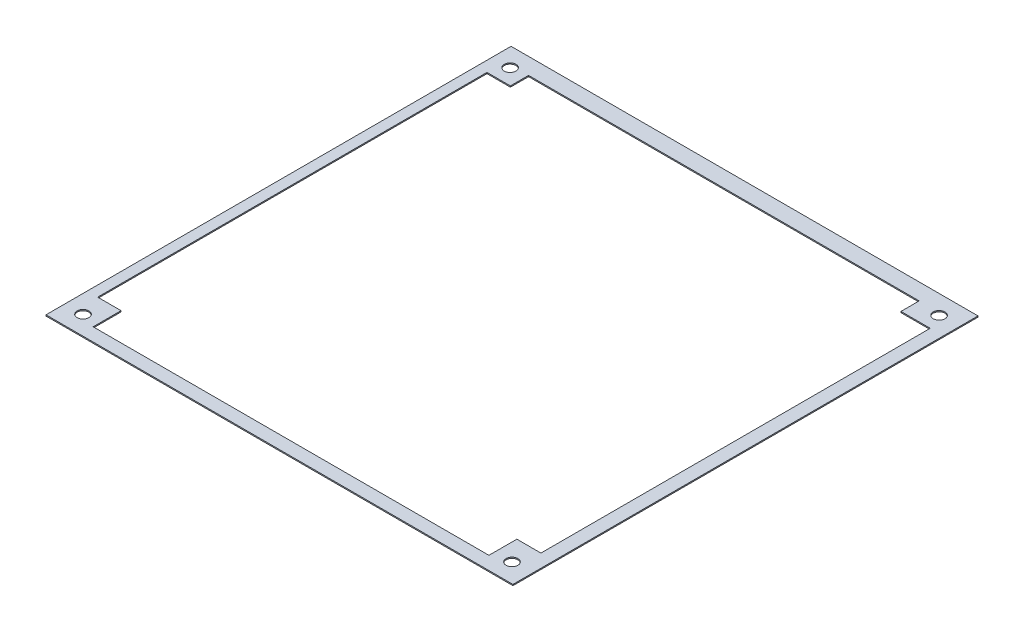
from build123d import *

# Parameters (mm, degrees)
BOSS_EXTRUDE1_DEPTH   = 5.5
BOSS_EXTRUDE1_2_DEPTH = 5.5
SKETCH2_W             = 112.4
SKETCH2_H             = 112.4
BOSS_EXTRUDE2_DEPTH   = 9.4
BOSS_EXTRUDE3_START   = 9.4
SKETCH2_3_W           = 246
SKETCH2_3_H           = 245
BOSS_EXTRUDE3_DEPTH   = 6
SKETCH3_R             = 3.1
CUT_EXTRUDE1_DEPTH    = 251.310147617
BOSS_EXTRUDE4_DEPTH   = 15
SKETCH5_W             = 16
SKETCH5_H             = 22.5
BOSS_EXTRUDE5_DEPTH   = 3.9
SKETCH6_W             = 16
SKETCH6_H             = 20.5
CUT_EXTRUDE2_DEPTH    = 3.4
CHAMFER1_SIZE         = 2
CHAMFER2_SIZE         = 3.05
CHAMFER3_SIZE         = 3
CHAMFER4_SIZE         = 3
SKETCH8_W             = 79.1
SKETCH8_H             = 5
CUT_EXTRUDE3_DEPTH    = 0.1
SKETCH9_W             = 246
SKETCH9_H             = 27.9
CUT_EXTRUDE4_DEPTH    = 324.051327191
CUT_EXTRUDE5_DEPTH    = 250.867004624


with BuildPart() as part:
    # Sketch1 → Boss-Extrude1 (new body)
    with BuildSketch(Plane(origin=(0, 0, 0), x_dir=(1, 0, 0), z_dir=(0, 1, 0))):
        Polygon((-6, -6), (-6, 106.4), (7.7, 106.4), (7.7, 100.4), (0, 100.4), (0, 0), (100.4, 0), (100.4, 40.9), (106.4, 40.9), (106.4, -6), align=None)
    extrude(amount=BOSS_EXTRUDE1_DEPTH)



with BuildPart() as body_2:
    # Sketch1 → Boss-Extrude1 2 (new body)
    with BuildSketch(Plane(origin=(0, 0, 0), x_dir=(1, 0, 0), z_dir=(0, 1, 0))):
        Polygon((92.7, 100.4), (92.7, 106.4), (106.4, 106.4), (106.4, 59.5), (100.4, 59.5), (100.4, 100.4), align=None)
    extrude(amount=BOSS_EXTRUDE1_2_DEPTH)


with BuildPart() as part_1:
    add(part.part)

    add(body_2.part)  # Boss-Extrude2 merges body 2
    # Sketch2 → Boss-Extrude2 (add)
    with BuildSketch(Plane.XZ):
        with Locations((50.2, -50.2)):
            Rectangle(SKETCH2_W, SKETCH2_H)
    extrude(amount=BOSS_EXTRUDE2_DEPTH)

    # Sketch2<3> → Boss-Extrude3 (add)
    with BuildSketch(Plane.XZ.offset(BOSS_EXTRUDE3_START)):
        with Locations((87, -12.9)):
            Rectangle(SKETCH2_3_W, SKETCH2_3_H)
    extrude(amount=BOSS_EXTRUDE3_DEPTH)

    # Sketch3 → Cut-Extrude1 (cut, through all)
    with BuildSketch(Plane(origin=(0, -9.4, 0), x_dir=(1, 0, 0), z_dir=(0, 1, 0))):
        with Locations(Location((-26.5, 125.4, 0), (0, 0, 270))):
            Circle(SKETCH3_R)
        with Locations(Location((-26.5, -99.6, 0), (0, 0, 90))):
            Circle(SKETCH3_R)
        with Locations(Location((199.5, 125.4, 0), (0, 0, 270))):
            Circle(SKETCH3_R)
        with Locations(Location((199.5, -99.6, 0), (0, 0, 270))):
            Circle(SKETCH3_R)
    extrude(amount=-CUT_EXTRUDE1_DEPTH, mode=Mode.SUBTRACT)

    # Sketch4 → Boss-Extrude4 (add)
    with BuildSketch(Plane(origin=(0, -9.4, 0), x_dir=(1, 0, 0), z_dir=(0, 1, 0))):
        with BuildLine():
            Line((-16, -109.6), (49, -109.6))
            Line((49, -109.6), (49, -6))
            Line((49, -6), (-36, -6))
            Line((-36, -6), (-36, -89.6))
            Line((-36, -89.6), (-22, -89.6))
            ThreePointArc((-22, -89.6), (-17.757359313, -91.357359313), (-16, -95.6))
            Line((-16, -95.6), (-16, -109.6))
        make_face()
    extrude(amount=BOSS_EXTRUDE4_DEPTH)

    # Sketch5 → Boss-Extrude5 (add)
    with BuildSketch(Plane(origin=(0, 0, -106.4), x_dir=(-1, 0, 0), z_dir=(0, 0, -1))):
        with Locations((-99.9, 1.85)):
            Rectangle(SKETCH5_W, SKETCH5_H)
        with Locations((-0.5, 1.85)):
            Rectangle(SKETCH5_W, SKETCH5_H)
    extrude(amount=BOSS_EXTRUDE5_DEPTH)

    # Sketch6 → Cut-Extrude2 (cut)
    with BuildSketch(Plane(origin=(0, 0, -110.3), x_dir=(-1, 0, 0), z_dir=(0, 0, -1))):
        with Locations((-0.5, 0.85)):
            Rectangle(SKETCH6_W, SKETCH6_H)
        with Locations((-99.9, 0.85)):
            Rectangle(SKETCH6_W, SKETCH6_H)
    extrude(amount=-CUT_EXTRUDE2_DEPTH, mode=Mode.SUBTRACT)

    # Chamfer1
    # the kernel refuses this chamfer: 2 mm, written as the material it adds along each edge
    with BuildSketch(Plane(origin=(92.7, -5.143365976, -106.4), x_dir=(-0.9996219169112968, 0, -0.027495876610589005), z_dir=(0, 1, 0))) as chamfer1_piece_1_section:
        Polygon((CHAMFER1_SIZE * 0.999621916911, CHAMFER1_SIZE * 0.0274958766106), (-CHAMFER1_SIZE * 0.0274958766106, CHAMFER1_SIZE * 0.999621916911), (0, 0), align=None)
    chamfer1_piece_1 = extrude(amount=10.643365976, mode=Mode.PRIVATE)
    chamfer1_piece_1 = split(chamfer1_piece_1, bisect_by=Plane(origin=(91.9, -2.571682988, -105.57221902), z_dir=(1, 0, 0)), keep=Keep.TOP, mode=Mode.PRIVATE)
    add(chamfer1_piece_1)
    with BuildSketch(Plane(origin=(92.7, 5.5, -106.4), x_dir=(0, 0.9996219169112968, -0.027495876610589075), z_dir=(1, 0, 0)), Plane(origin=(-6, 5.5, -106.4), x_dir=(0, 0.9996219169112968, -0.027495876610589075), z_dir=(1, 0, 0))) as chamfer1_piece_2:
        Polygon((CHAMFER1_SIZE * 0.999621916911, CHAMFER1_SIZE * 0.0274958766106), (-CHAMFER1_SIZE * 0.0274958766106, CHAMFER1_SIZE * 0.999621916911), (0, 0), align=None)
    extrude(amount=13.7)
    with BuildSketch(Plane(origin=(106.4, 5.5, -106.4), x_dir=(-0.027495876610589005, 0, 0.9996219169112968), z_dir=(0, -1, 0))) as chamfer1_piece_3_section:
        Polygon((CHAMFER1_SIZE * 0.999621916911, -CHAMFER1_SIZE * 0.0274958766106), (-CHAMFER1_SIZE * 0.0274958766106, -CHAMFER1_SIZE * 0.999621916911), (0, 0), align=None)
    chamfer1_piece_3 = extrude(amount=14.9, mode=Mode.PRIVATE)
    chamfer1_piece_3 = split(chamfer1_piece_3, bisect_by=Plane(origin=(107.9, -1.95, -105.69608178), z_dir=(-1, 0, 0)), keep=Keep.TOP, mode=Mode.PRIVATE)
    add(chamfer1_piece_3)
    with BuildSketch(Plane(origin=(106.4, 5.5, -106.4), x_dir=(-0.027495876610589005, 0, 0.9996219169112968), z_dir=(0, -1, 0))) as chamfer1_piece_4_section:
        Polygon((CHAMFER1_SIZE * 0.999621916911, -CHAMFER1_SIZE * 0.0274958766106), (-CHAMFER1_SIZE * 0.0274958766106, -CHAMFER1_SIZE * 0.999621916911), (0, 0), align=None)
    chamfer1_piece_4 = extrude(amount=20.043365976, mode=Mode.PRIVATE)
    chamfer1_piece_4 = split(chamfer1_piece_4, bisect_by=Plane(origin=(106.974972825, -9.4, -105.69608178), z_dir=(0, -1, 0)), keep=Keep.TOP, mode=Mode.PRIVATE)
    chamfer1_piece_4 = split(chamfer1_piece_4, bisect_by=Plane(origin=(107.9, -11.971682988, -105.69608178), z_dir=(-1, 0, 0)), keep=Keep.TOP, mode=Mode.PRIVATE)
    add(chamfer1_piece_4)
    with BuildSketch(Plane(origin=(106.4, 5.5, -106.4), x_dir=(-0.027495876610589005, 0, 0.9996219169112968), z_dir=(0, -1, 0))) as chamfer1_piece_5_section:
        Polygon((CHAMFER1_SIZE * 0.999621916911, -CHAMFER1_SIZE * 0.0274958766106), (-CHAMFER1_SIZE * 0.0274958766106, -CHAMFER1_SIZE * 0.999621916911), (0, 0), align=None)
    chamfer1_piece_5 = extrude(amount=20.043365976, mode=Mode.PRIVATE)
    chamfer1_piece_5 = split(chamfer1_piece_5, bisect_by=Plane(origin=(108.09753906, -9.4, -106.284213701), z_dir=(0, -1, 0)), keep=Keep.TOP, mode=Mode.PRIVATE)
    chamfer1_piece_5 = split(chamfer1_piece_5, bisect_by=Plane(origin=(107.9, -11.971682988, -106.284213701), z_dir=(1, 0, 0)), keep=Keep.TOP, mode=Mode.PRIVATE)
    add(chamfer1_piece_5)
    with BuildSketch(Plane(origin=(7.7, -5.143365976, -106.4), x_dir=(0.9996219169112965, 0, -0.027495876610589057), z_dir=(0, 1, 0))) as chamfer1_piece_6_section:
        Polygon((CHAMFER1_SIZE * 0.999621916911, -CHAMFER1_SIZE * 0.0274958766106), (-CHAMFER1_SIZE * 0.0274958766106, -CHAMFER1_SIZE * 0.999621916911), (0, 0), align=None)
    chamfer1_piece_6 = extrude(amount=10.643365976, mode=Mode.PRIVATE)
    chamfer1_piece_6 = split(chamfer1_piece_6, bisect_by=Plane(origin=(8.5, -2.571682988, -105.57221902), z_dir=(-1, 0, 0)), keep=Keep.TOP, mode=Mode.PRIVATE)
    add(chamfer1_piece_6)
    with BuildSketch(Plane(origin=(-6, 5.5, -106.4), x_dir=(-0.9996219169112968, 0, -0.027495876610589075), z_dir=(0, -1, 0))) as chamfer1_piece_7_section:
        Polygon((CHAMFER1_SIZE * 0.999621916911, -CHAMFER1_SIZE * 0.0274958766106), (-CHAMFER1_SIZE * 0.0274958766106, -CHAMFER1_SIZE * 0.999621916911), (0, 0), align=None)
    chamfer1_piece_7 = extrude(amount=14.9, mode=Mode.PRIVATE)
    chamfer1_piece_7 = split(chamfer1_piece_7, bisect_by=Plane(origin=(-7.5, -1.95, -105.69608178), z_dir=(1, 0, 0)), keep=Keep.TOP, mode=Mode.PRIVATE)
    add(chamfer1_piece_7)
    with BuildSketch(Plane(origin=(-6, 5.5, -106.4), x_dir=(-0.9996219169112968, 0, -0.027495876610589075), z_dir=(0, -1, 0))) as chamfer1_piece_8_section:
        Polygon((CHAMFER1_SIZE * 0.999621916911, -CHAMFER1_SIZE * 0.0274958766106), (-CHAMFER1_SIZE * 0.0274958766106, -CHAMFER1_SIZE * 0.999621916911), (0, 0), align=None)
    chamfer1_piece_8 = extrude(amount=20.043365976, mode=Mode.PRIVATE)
    chamfer1_piece_8 = split(chamfer1_piece_8, bisect_by=Plane(origin=(-7.69753906, -9.4, -106.284213701), z_dir=(0, -1, 0)), keep=Keep.TOP, mode=Mode.PRIVATE)
    chamfer1_piece_8 = split(chamfer1_piece_8, bisect_by=Plane(origin=(-7.5, -11.971682988, -106.284213701), z_dir=(-1, 0, 0)), keep=Keep.TOP, mode=Mode.PRIVATE)
    add(chamfer1_piece_8)
    with BuildSketch(Plane(origin=(-6, 5.5, -106.4), x_dir=(-0.9996219169112968, 0, -0.027495876610589075), z_dir=(0, -1, 0))) as chamfer1_piece_9_section:
        Polygon((CHAMFER1_SIZE * 0.999621916911, -CHAMFER1_SIZE * 0.0274958766106), (-CHAMFER1_SIZE * 0.0274958766106, -CHAMFER1_SIZE * 0.999621916911), (0, 0), align=None)
    chamfer1_piece_9 = extrude(amount=20.043365976, mode=Mode.PRIVATE)
    chamfer1_piece_9 = split(chamfer1_piece_9, bisect_by=Plane(origin=(-6.574972825, -9.4, -105.69608178), z_dir=(0, -1, 0)), keep=Keep.TOP, mode=Mode.PRIVATE)
    chamfer1_piece_9 = split(chamfer1_piece_9, bisect_by=Plane(origin=(-7.5, -11.971682988, -105.69608178), z_dir=(1, 0, 0)), keep=Keep.TOP, mode=Mode.PRIVATE)
    add(chamfer1_piece_9)
    with BuildSketch(Plane(origin=(87.556634024, 5.5, -106.4), x_dir=(0, 0.9996219169112968, -0.027495876610589075), z_dir=(1, 0, 0))) as chamfer1_piece_10a_section:
        Polygon((CHAMFER1_SIZE * 0.999621916911, CHAMFER1_SIZE * 0.0274958766106), (-CHAMFER1_SIZE * 0.0274958766106, CHAMFER1_SIZE * 0.999621916911), (0, 0), align=None)
    chamfer1_piece_10a = extrude(amount=18.843365976, mode=Mode.PRIVATE)
    chamfer1_piece_10a = split(chamfer1_piece_10a, bisect_by=Plane(origin=(91.9, 6.159587254, -105.740412746), z_dir=(1, 0, 0)), keep=Keep.TOP, mode=Mode.PRIVATE)
    chamfer1_piece_10a = split(chamfer1_piece_10a, bisect_by=Plane(origin=(92.7, 6.159587254, -105.740412746), z_dir=(-1, 0, 0)), keep=Keep.TOP, mode=Mode.PRIVATE)
    with BuildSketch(Plane(origin=(92.7, 0, -106.4), x_dir=(-0.9996219169112968, 0, -0.027495876610589005), z_dir=(0, 1, 0))) as chamfer1_piece_10b_section:
        Polygon((CHAMFER1_SIZE * 0.999621916911, CHAMFER1_SIZE * 0.0274958766106), (-CHAMFER1_SIZE * 0.0274958766106, CHAMFER1_SIZE * 0.999621916911), (0, 0), align=None)
    chamfer1_piece_10b = extrude(amount=10.643365976, mode=Mode.PRIVATE)
    chamfer1_piece_10b = split(chamfer1_piece_10b, bisect_by=Plane(origin=(91.9, 8.071682988, -105.57221902), z_dir=(1, 0, 0)), keep=Keep.TOP, mode=Mode.PRIVATE)
    chamfer1_piece_10b = split(chamfer1_piece_10b, bisect_by=Plane(origin=(92.36112716, 5.5, -105.57221902), z_dir=(0, 1, 0)), keep=Keep.TOP, mode=Mode.PRIVATE)
    chamfer1_piece_10 = chamfer1_piece_10a & chamfer1_piece_10b
    add(chamfer1_piece_10)
    with BuildSketch(Plane(origin=(106.4, 10.643365976, -106.4), x_dir=(-0.027495876610589005, 0, 0.9996219169112968), z_dir=(0, -1, 0))) as chamfer1_piece_11a_section:
        Polygon((CHAMFER1_SIZE * 0.999621916911, -CHAMFER1_SIZE * 0.0274958766106), (-CHAMFER1_SIZE * 0.0274958766106, -CHAMFER1_SIZE * 0.999621916911), (0, 0), align=None)
    chamfer1_piece_11a = extrude(amount=20.043365976, mode=Mode.PRIVATE)
    chamfer1_piece_11a = split(chamfer1_piece_11a, bisect_by=Plane(origin=(106.974972825, 5.5, -105.69608178), z_dir=(0, 1, 0)), keep=Keep.TOP, mode=Mode.PRIVATE)
    chamfer1_piece_11a = split(chamfer1_piece_11a, bisect_by=Plane(origin=(107.9, 8.071682988, -105.69608178), z_dir=(-1, 0, 0)), keep=Keep.TOP, mode=Mode.PRIVATE)
    with BuildSketch(Plane(origin=(92.7, 5.5, -106.4), x_dir=(0, 0.9996219169112968, -0.027495876610589075), z_dir=(1, 0, 0))) as chamfer1_piece_11b_section:
        Polygon((CHAMFER1_SIZE * 0.999621916911, CHAMFER1_SIZE * 0.0274958766106), (-CHAMFER1_SIZE * 0.0274958766106, CHAMFER1_SIZE * 0.999621916911), (0, 0), align=None)
    chamfer1_piece_11b = extrude(amount=18.843365976, mode=Mode.PRIVATE)
    chamfer1_piece_11b = split(chamfer1_piece_11b, bisect_by=Plane(origin=(106.4, 6.159587254, -105.740412746), z_dir=(1, 0, 0)), keep=Keep.TOP, mode=Mode.PRIVATE)
    chamfer1_piece_11b = split(chamfer1_piece_11b, bisect_by=Plane(origin=(107.9, 6.159587254, -105.740412746), z_dir=(-1, 0, 0)), keep=Keep.TOP, mode=Mode.PRIVATE)
    chamfer1_piece_11 = chamfer1_piece_11a & chamfer1_piece_11b
    add(chamfer1_piece_11)
    with BuildSketch(Plane(origin=(-6, 5.5, -106.4), x_dir=(0, 0.9996219169112968, -0.027495876610589075), z_dir=(1, 0, 0))) as chamfer1_piece_12a_section:
        Polygon((CHAMFER1_SIZE * 0.999621916911, CHAMFER1_SIZE * 0.0274958766106), (-CHAMFER1_SIZE * 0.0274958766106, CHAMFER1_SIZE * 0.999621916911), (0, 0), align=None)
    chamfer1_piece_12a = extrude(amount=18.843365976, mode=Mode.PRIVATE)
    chamfer1_piece_12a = split(chamfer1_piece_12a, bisect_by=Plane(origin=(8.5, 6.159587254, -105.740412746), z_dir=(-1, 0, 0)), keep=Keep.TOP, mode=Mode.PRIVATE)
    chamfer1_piece_12a = split(chamfer1_piece_12a, bisect_by=Plane(origin=(7.7, 6.159587254, -105.740412746), z_dir=(1, 0, 0)), keep=Keep.TOP, mode=Mode.PRIVATE)
    with BuildSketch(Plane(origin=(7.7, 0, -106.4), x_dir=(0.9996219169112965, 0, -0.027495876610589057), z_dir=(0, 1, 0))) as chamfer1_piece_12b_section:
        Polygon((CHAMFER1_SIZE * 0.999621916911, -CHAMFER1_SIZE * 0.0274958766106), (-CHAMFER1_SIZE * 0.0274958766106, -CHAMFER1_SIZE * 0.999621916911), (0, 0), align=None)
    chamfer1_piece_12b = extrude(amount=10.643365976, mode=Mode.PRIVATE)
    chamfer1_piece_12b = split(chamfer1_piece_12b, bisect_by=Plane(origin=(8.5, 8.071682988, -105.57221902), z_dir=(-1, 0, 0)), keep=Keep.TOP, mode=Mode.PRIVATE)
    chamfer1_piece_12b = split(chamfer1_piece_12b, bisect_by=Plane(origin=(8.03887284, 5.5, -105.57221902), z_dir=(0, 1, 0)), keep=Keep.TOP, mode=Mode.PRIVATE)
    chamfer1_piece_12 = chamfer1_piece_12a & chamfer1_piece_12b
    add(chamfer1_piece_12)
    with BuildSketch(Plane(origin=(-6, 10.643365976, -106.4), x_dir=(-0.9996219169112968, 0, -0.027495876610589075), z_dir=(0, -1, 0))) as chamfer1_piece_13a_section:
        Polygon((CHAMFER1_SIZE * 0.999621916911, -CHAMFER1_SIZE * 0.0274958766106), (-CHAMFER1_SIZE * 0.0274958766106, -CHAMFER1_SIZE * 0.999621916911), (0, 0), align=None)
    chamfer1_piece_13a = extrude(amount=20.043365976, mode=Mode.PRIVATE)
    chamfer1_piece_13a = split(chamfer1_piece_13a, bisect_by=Plane(origin=(-7.5, 8.071682988, -105.69608178), z_dir=(1, 0, 0)), keep=Keep.TOP, mode=Mode.PRIVATE)
    chamfer1_piece_13a = split(chamfer1_piece_13a, bisect_by=Plane(origin=(-6.574972825, 5.5, -105.69608178), z_dir=(0, 1, 0)), keep=Keep.TOP, mode=Mode.PRIVATE)
    with BuildSketch(Plane(origin=(-11.143365976, 5.5, -106.4), x_dir=(0, 0.9996219169112968, -0.027495876610589075), z_dir=(1, 0, 0))) as chamfer1_piece_13b_section:
        Polygon((CHAMFER1_SIZE * 0.999621916911, CHAMFER1_SIZE * 0.0274958766106), (-CHAMFER1_SIZE * 0.0274958766106, CHAMFER1_SIZE * 0.999621916911), (0, 0), align=None)
    chamfer1_piece_13b = extrude(amount=18.843365976, mode=Mode.PRIVATE)
    chamfer1_piece_13b = split(chamfer1_piece_13b, bisect_by=Plane(origin=(-7.5, 6.159587254, -105.740412746), z_dir=(1, 0, 0)), keep=Keep.TOP, mode=Mode.PRIVATE)
    chamfer1_piece_13b = split(chamfer1_piece_13b, bisect_by=Plane(origin=(-6, 6.159587254, -105.740412746), z_dir=(-1, 0, 0)), keep=Keep.TOP, mode=Mode.PRIVATE)
    chamfer1_piece_13 = chamfer1_piece_13a & chamfer1_piece_13b
    add(chamfer1_piece_13)
    # the kernel refuses this chamfer: 2 mm, written as the material it takes off along each edge
    with BuildSketch(Plane(origin=(113.043365976, 13.1, -106.4), x_dir=(1.4427442484973125e-15, -0.9996219169112968, 0.027495876610589075), z_dir=(-1, 0, 0)), Plane(origin=(-12.643365976, 13.1, -106.4), x_dir=(0, 0.027495876610586414, -0.9996219169112968), z_dir=(1, 0, 0))) as chamfer1_2_piece_1:
        Polygon((CHAMFER1_SIZE * 0.999621916911, -CHAMFER1_SIZE * 0.0274958766106), (-CHAMFER1_SIZE * 0.0274958766106, -CHAMFER1_SIZE * 0.999621916911), (0, 0), align=None)
    extrude(amount=26.286731952, mode=Mode.SUBTRACT)

    # Chamfer2
    chamfer2_edges = [part_1.edges().sort_by_distance(p)[0] for p in [
        (199.5, -9.4, -128.5),
        (-26.5, -9.4, -128.5),
        (-26.5, -9.4, 102.7),
        (199.5, -9.4, 96.5),
    ]]
    chamfer(chamfer2_edges, length=CHAMFER2_SIZE)

    # Chamfer3
    chamfer3_edges = [part_1.edges().sort_by_distance(p)[0] for p in [
        (106.4, 5.5, -17.45),
    ]]
    chamfer(chamfer3_edges, length=CHAMFER3_SIZE)
    chamfer3_2_edges = [part_1.edges().sort_by_distance(p)[0] for p in [
        (106.4, 5.5, -81.95),
    ]]
    chamfer(chamfer3_2_edges, length=CHAMFER3_SIZE)
    chamfer3_3_edges = [part_1.edges().sort_by_distance(p)[0] for p in [
        (76.2, 5.5, 6),
    ]]
    chamfer(chamfer3_3_edges, length=CHAMFER3_SIZE)
    chamfer3_4_edges = [part_1.edges().sort_by_distance(p)[0] for p in [
        (49, 5.6, 57.8),
    ]]
    chamfer(chamfer3_4_edges, length=CHAMFER3_SIZE)
    chamfer3_5_edges = [part_1.edges().sort_by_distance(p)[0] for p in [
        (15, 5.6, 109.6),
    ]]
    chamfer(chamfer3_5_edges, length=CHAMFER3_SIZE)
    chamfer3_6_edges = [part_1.edges().sort_by_distance(p)[0] for p in [
        (-36, 5.6, 47.8),
    ]]
    chamfer(chamfer3_6_edges, length=CHAMFER3_SIZE)
    chamfer3_7_edges = [part_1.edges().sort_by_distance(p)[0] for p in [
        (-6, 5.5, -49.2),
    ]]
    chamfer(chamfer3_7_edges, length=CHAMFER3_SIZE)
    chamfer3_8_edges = [part_1.edges().sort_by_distance(p)[0] for p in [
        (-16, 5.6, 101.1),
        (-27.5, 5.6, 89.6),
        (-17.757359313, 5.6, 91.357359313),
    ]]
    chamfer(chamfer3_8_edges, length=CHAMFER3_SIZE)

    # Chamfer4
    chamfer4_edges = [part_1.edges().sort_by_distance(p)[0] for p in [
        (-36, -9.4, -64.7),
        (129.5, -9.4, 109.6),
        (-36, -3.4, 89.6),
        (-36, -3.4, 6),
        (-16, -3.4, 109.6),
        (49, -3.4, 109.6),
        (-36, -9.4, 99.6),
        (87, -9.4, -135.4),
        (-26, -9.4, 109.6),
        (210, -9.4, -12.9),
    ]]
    chamfer(chamfer4_edges, length=CHAMFER4_SIZE)

    # Sketch8 → Cut-Extrude3 (cut)
    with BuildSketch(Plane(origin=(0, 5.6, 0), x_dir=(1, 0, 0), z_dir=(0, 1, 0))):
        with Locations((6.55, -8.5)):
            Rectangle(SKETCH8_W, SKETCH8_H)
    extrude(amount=-CUT_EXTRUDE3_DEPTH, mode=Mode.SUBTRACT)

    # Chamfer5
    # the kernel refuses this chamfer: 3 mm, written as the material it takes off along each edge
    with BuildSketch(Plane(origin=(6.229157809, 5.5, 6), x_dir=(0, -0.9850292351397439, -0.17238737169529297), z_dir=(-1, 0, 0))) as chamfer5_piece_1_section:
        with BuildLine():
            Line((3.691663124, 0), (-1.253737533, 3.472249821))
            Line((-1.253737533, 3.472249821), (-1.697000689, 3.394675503))
            ThreePointArc((-1.697000689, 3.394675503), (-0.756697539, 1.713403919), (-0.443263156, -0.077574317))
            Line((-0.443263156, -0.077574317), (0.077574317, -0.443263156))
            ThreePointArc((0.077574317, -0.443263156), (1.868552553, -0.129828772), (3.769237441, -0.443263156))
            Line((3.769237441, -0.443263156), (3.691663124, 0))
        make_face()
    chamfer5_piece_1 = extrude(amount=39.229157809, mode=Mode.PRIVATE)
    chamfer5_piece_1 = split(chamfer5_piece_1, bisect_by=Plane(origin=(-4.039459416, 4.460540584, 7.280331392), z_dir=(-0.7071067811865476, 0.7071067811865476, 0)), keep=Keep.TOP, mode=Mode.PRIVATE)
    chamfer5_piece_1 = split(chamfer5_piece_1, bisect_by=Plane(origin=(-6, 5.114054112, 7.280331392), z_dir=(1, 0, 0)), keep=Keep.TOP, mode=Mode.PRIVATE)
    add(chamfer5_piece_1, mode=Mode.SUBTRACT)
    with BuildSketch(Plane(origin=(6.229157809, 5.5, 6), x_dir=(0, -0.9850292351397439, -0.17238737169529297), z_dir=(-1, 0, 0))) as chamfer5_piece_2_section:
        with BuildLine():
            Line((3.691663124, 0), (-1.253737533, 3.472249821))
            Line((-1.253737533, 3.472249821), (-1.697000689, 3.394675503))
            ThreePointArc((-1.697000689, 3.394675503), (-0.756697539, 1.713403919), (-0.443263156, -0.077574317))
            Line((-0.443263156, -0.077574317), (0.077574317, -0.443263156))
            ThreePointArc((0.077574317, -0.443263156), (1.868552553, -0.129828772), (3.769237441, -0.443263156))
            Line((3.769237441, -0.443263156), (3.691663124, 0))
        make_face()
    chamfer5_piece_2 = extrude(amount=39.229157809, mode=Mode.PRIVATE)
    chamfer5_piece_2 = split(chamfer5_piece_2, bisect_by=Plane(origin=(-6.302738925, 2.197261075, 5.315019574), z_dir=(0.7071067811865476, -0.7071067811865476, 0)), keep=Keep.TOP, mode=Mode.PRIVATE)
    chamfer5_piece_2 = split(chamfer5_piece_2, bisect_by=Plane(origin=(-6, 2.0963481, 5.315019574), z_dir=(-1, 0, 0)), keep=Keep.TOP, mode=Mode.PRIVATE)
    add(chamfer5_piece_2, mode=Mode.SUBTRACT)
    with BuildSketch(Plane(origin=(6.229157809, 5.5, 6), x_dir=(0, -0.9850292351397439, -0.17238737169529297), z_dir=(-1, 0, 0))) as chamfer5_piece_3_section:
        with BuildLine():
            Line((3.691663124, 0), (-1.253737533, 3.472249821))
            Line((-1.253737533, 3.472249821), (-1.697000689, 3.394675503))
            ThreePointArc((-1.697000689, 3.394675503), (-0.756697539, 1.713403919), (-0.443263156, -0.077574317))
            Line((-0.443263156, -0.077574317), (0.077574317, -0.443263156))
            ThreePointArc((0.077574317, -0.443263156), (1.868552553, -0.129828772), (3.769237441, -0.443263156))
            Line((3.769237441, -0.443263156), (3.691663124, 0))
        make_face()
    chamfer5_piece_3 = extrude(amount=39.229157809, mode=Mode.PRIVATE)
    chamfer5_piece_3 = split(chamfer5_piece_3, bisect_by=Plane(origin=(-11.711520685, -3.211520685, 6.918404597), z_dir=(-0.7071067811865476, 0.7071067811865476, 0)), keep=Keep.TOP, mode=Mode.PRIVATE)
    chamfer5_piece_3 = split(chamfer5_piece_3, bisect_by=Plane(origin=(-6, 4.583653926, 6.918404597), z_dir=(-1, 0, 0)), keep=Keep.TOP, mode=Mode.PRIVATE)
    add(chamfer5_piece_3, mode=Mode.SUBTRACT)
    with BuildSketch(Plane(origin=(6.229157809, 5.5, 6), x_dir=(0, -0.9850292351397439, -0.17238737169529297), z_dir=(-1, 0, 0))) as chamfer5_piece_4_section:
        with BuildLine():
            Line((3.691663124, 0), (-1.253737533, 3.472249821))
            Line((-1.253737533, 3.472249821), (-1.697000689, 3.394675503))
            ThreePointArc((-1.697000689, 3.394675503), (-0.756697539, 1.713403919), (-0.443263156, -0.077574317))
            Line((-0.443263156, -0.077574317), (0.077574317, -0.443263156))
            ThreePointArc((0.077574317, -0.443263156), (1.868552553, -0.129828772), (3.769237441, -0.443263156))
            Line((3.769237441, -0.443263156), (3.691663124, 0))
        make_face()
    chamfer5_piece_4 = extrude(amount=48.458315618, mode=Mode.PRIVATE)
    chamfer5_piece_4 = split(chamfer5_piece_4, bisect_by=Plane(origin=(-33, 4.582402261, 6.917597739), z_dir=(-1, 0, 0)), keep=Keep.TOP, mode=Mode.PRIVATE)
    add(chamfer5_piece_4, mode=Mode.SUBTRACT)

    # Sketch9 → Cut-Extrude4 (cut, through all)
    with BuildSketch(Plane.XY.offset(109.6)):
        with Locations((87, -0.85)):
            Rectangle(SKETCH9_W, SKETCH9_H)
    extrude(amount=-CUT_EXTRUDE4_DEPTH, mode=Mode.SUBTRACT)

    # Sketch10 → Cut-Extrude5 (cut, through all)
    with BuildSketch(Plane(origin=(0, -14.8, 0), x_dir=(1, 0, 0), z_dir=(0, 1, 0))):
        Polygon((-13.320267735, 126.74467243), (187.662657728, 126.74467243), (187.662657728, 117.157752647), (203.07020738, 117.157752647), (203.07020738, -87.933852724), (190.401777666, -87.933852724), (190.401777666, -102.656622391), (-18.113727627, -102.656622391), (-18.113727627, -87.933852724), (-30.439767349, -87.933852724), (-30.439767349, 117.157752647), (-18.113727627, 117.157752647), (-18.113727627, 126.74467243), align=None)
    extrude(amount=-CUT_EXTRUDE5_DEPTH, mode=Mode.SUBTRACT)


solid = part_1.part
